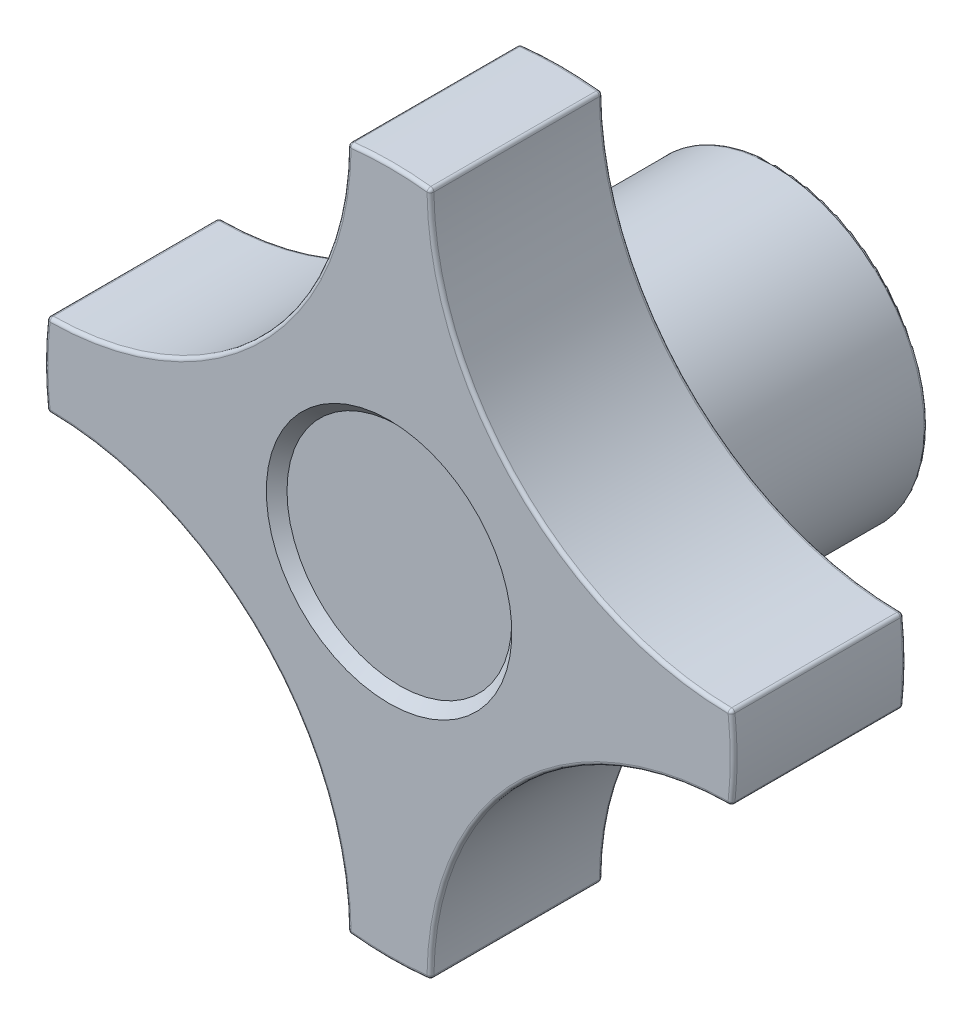
from build123d import *

# Parameters (mm, degrees)
SKETCH1_W                = 15.875
SKETCH1_H                = 6.35
LPATTERN1_COUNT          = 13
LPATTERN1_PITCH          = 1.27
LPATTERN1_COL_COUNT      = 2
LPATTERN1_COL_PITCH      = 1.27
SKETCH9_W                = 16.51
SKETCH9_H                = 6.985
CUT_EXTRUDE1_DEPTH       = 12.7
FILLET1_R                = 0.254
CIRPATTERN1_COUNT        = 4
FILLET1_OF_CIRPATTERN1_R = 0.254
FILLET2_R                = 0.254


with BuildPart() as part:
    # Sketch1 → Revolve1 (revolve)
    with BuildSketch(Plane(origin=(0, 0, 0), x_dir=(0, 0, -1), z_dir=(1, 0, 0)), mode=Mode.PRIVATE) as revolve1_sk:
        with Locations((0, 3.175)):
            Rectangle(SKETCH1_W, SKETCH1_H)
    revolve(revolve1_sk.sketch.rotate(Axis((0, 0, 8.5598), (0, 0, -1)), 180), axis=Axis((0, 0, 8.5598), (0, 0, -1)))

    # Sketch2 → Cut-Revolve1 (revolve, cut)
    with BuildSketch(Plane(origin=(0, 0, 0), x_dir=(0, 0, -1), z_dir=(1, 0, 0)), mode=Mode.PRIVATE) as cut_revolve1_sk:
        Polygon((-7.779537846, 6.365796215), (-6.673802768, 6.476369723), (-7.000308534, 5.752882994), (-7.316232842, 5.721290563), align=None)
    cut_revolve1 = revolve(cut_revolve1_sk.sketch.rotate(Axis((0, -0.135293799, 7.9375), (0, 0.09950371902099923, -0.9950371902099892)), 180), axis=Axis((0, -0.135293799, 7.9375), (0, 0.09950371902099923, -0.9950371902099892)), mode=Mode.SUBTRACT)

    # LPattern1: Cut-Revolve1 ×13
    with Locations(*[(0, 0, -i * LPATTERN1_PITCH) for i in range(1, LPATTERN1_COUNT)]):
        add(cut_revolve1, mode=Mode.SUBTRACT)

    # LPattern1 col: Cut-Revolve1 ×2
    with Locations(*[(0, 0, i * LPATTERN1_COL_PITCH) for i in range(1, LPATTERN1_COL_COUNT)]):
        add(cut_revolve1, mode=Mode.SUBTRACT)


with BuildPart() as body_2:
    # Sketch9 → Revolve4 (revolve)
    with BuildSketch(Plane(origin=(0, 0, 0), x_dir=(0, 0, -1), z_dir=(1, 0, 0)), mode=Mode.PRIVATE) as revolve4_sk:
        with Locations((-0.3175, 3.4925)):
            Rectangle(SKETCH9_W, SKETCH9_H)
    revolve(revolve4_sk.sketch.rotate(Axis((0, 0, -7.9375), (0, 0, 1)), 144.237011276), axis=Axis((0, 0, -7.9375), (0, 0, 1)))

    # Combine4: read off the stored shape, not the designer's step
    # Combine4: cut part
    add(part.part, mode=Mode.SUBTRACT)

    # Sketch8 → Cut-Revolve3 (revolve, cut)
    with BuildSketch(Plane(origin=(0, 0, 0), x_dir=(0, 0, -1), z_dir=(1, 0, 0)), mode=Mode.PRIVATE) as cut_revolve3_sk:
        Polygon((7.9375, 6.35), (7.308790563, 5.721290563), (7.308790563, 0), (7.9375, 0), align=None)
    revolve(cut_revolve3_sk.sketch.rotate(Axis((0, 0, -7.9375), (0, 0, 1)), 144.237011276), axis=Axis((0, 0, -7.9375), (0, 0, 1)), mode=Mode.SUBTRACT)


with BuildPart() as body_2_2:
    # Sketch5 → Revolve3 (revolve)
    with BuildSketch(Plane(origin=(0, 0, 0), x_dir=(0, 0, -1), z_dir=(1, 0, 0)), mode=Mode.PRIVATE) as revolve3_sk:
        Polygon((7.9375, 11.1125), (-7.9375, 11.1125), (-7.9375, 25.4), (-20.6375, 25.4), (-20.6375, 0), (-8.5725, 0), (-8.5725, 6.985), (7.9375, 6.985), align=None)
    revolve(revolve3_sk.sketch.rotate(Axis((0, 0, 8.5725), (0, 0, -1)), 215.762988724), axis=Axis((0, 0, 8.5725), (0, 0, -1)))

    # Sketch6 → Cut-Extrude1 (cut)
    with BuildSketch(Plane.XY.offset(20.6375)):
        with BuildLine():
            Line((-25.216361201, 25.216361201), (-9.541522129, 9.541522129))
            ThreePointArc((-9.541522129, 9.541522129), (-4.736196989, 16.733199425), (-3.048791197, 25.216361201))
            ThreePointArc((-3.048791197, 25.216361201), (0, 25.4), (3.048791197, 25.216361201))
            ThreePointArc((3.048791197, 25.216361201), (4.736196989, 16.733199425), (9.541522129, 9.541522129))
            Line((9.541522129, 9.541522129), (25.216361201, 25.216361201))
            ThreePointArc((25.216361201, 25.216361201), (0, 35.661320005), (-25.216361201, 25.216361201))
        make_face()
    cut_extrude1 = extrude(amount=-CUT_EXTRUDE1_DEPTH, mode=Mode.SUBTRACT)

    # Fillet1
    fillet1_edges = [body_2_2.edges().sort_by_distance(p)[0] for p in [
        (3.048791197, 25.216361201, 14.2875),
        (-3.048791197, 25.216361201, 14.2875),
    ]]
    fillet(fillet1_edges, radius=FILLET1_R)

    # CirPattern1: Cut-Extrude1 ×4 about axis
    cirpattern1_axis = Axis((0, 0, 0), (0, 0, 1))
    for i in range(1, CIRPATTERN1_COUNT):
        add(cut_extrude1.rotate(cirpattern1_axis, i * 360 / CIRPATTERN1_COUNT), mode=Mode.SUBTRACT)

    # Fillet1 of CirPattern1
    fillet1_of_cirpattern1_edges = [body_2_2.edges().sort_by_distance(p)[0] for p in [
        (-25.216361201, 3.048791197, 14.2875),
        (-25.216361201, -3.048791197, 14.2875),
        (-3.048791197, -25.216361201, 14.2875),
        (3.048791197, -25.216361201, 14.2875),
        (25.216361201, -3.048791197, 14.2875),
        (25.216361201, 3.048791197, 14.2875),
    ]]
    fillet(fillet1_of_cirpattern1_edges, radius=FILLET1_OF_CIRPATTERN1_R)

    # Fillet2
    fillet2_edges = [body_2_2.edges().sort_by_distance(p)[0] for p in [
        (-2.984403179, -25.160358744, 7.9375),
        (9.541522129, -9.541522129, 20.6375),
        (25.4, 0, 20.6375),
        (25.160358744, 2.984403179, 20.6375),
        (25.160358744, -2.984403179, 20.6375),
        (25.4, 0, 7.9375),
        (9.541522129, 9.541522129, 7.9375),
        (25.160358744, 2.984403179, 7.9375),
        (25.160358744, -2.984403179, 7.9375),
        (9.541522129, 9.541522129, 20.6375),
        (0, 25.4, 20.6375),
        (-2.984403179, 25.160358744, 20.6375),
        (2.984403179, 25.160358744, 20.6375),
        (0, 25.4, 7.9375),
        (-9.541522129, 9.541522129, 7.9375),
        (-2.984403179, 25.160358744, 7.9375),
        (2.984403179, 25.160358744, 7.9375),
        (6.494518727, 9.017143825, -7.9375),
        (-9.541522129, 9.541522129, 20.6375),
        (-25.4, 0, 20.6375),
        (-25.160358744, -2.984403179, 20.6375),
        (-25.160358744, 2.984403179, 20.6375),
        (-25.4, 0, 7.9375),
        (-9.541522129, -9.541522129, 7.9375),
        (-25.160358744, -2.984403179, 7.9375),
        (-25.160358744, 2.984403179, 7.9375),
        (-9.541522129, -9.541522129, 20.6375),
        (0, -25.4, 20.6375),
        (2.984403179, -25.160358744, 20.6375),
        (-2.984403179, -25.160358744, 20.6375),
        (0, -25.4, 7.9375),
        (9.541522129, -9.541522129, 7.9375),
        (2.984403179, -25.160358744, 7.9375),
    ]]
    fillet(fillet2_edges, radius=FILLET2_R - 0.0001)  # a hair under: the kernel refuses the full size

    # Sketch10 → Cut-Revolve4 (revolve, cut)
    with BuildSketch(Plane(origin=(0, 0, 0), x_dir=(0, 0, -1), z_dir=(1, 0, 0)), mode=Mode.PRIVATE) as cut_revolve4_sk:
        Polygon((-20.6375, 0), (-20.6375, 9.04875), (-19.8755, 8.28675), (-19.8755, 0), align=None)
    revolve(cut_revolve4_sk.sketch.rotate(Axis((0, 0, 20.6375), (0, 0, -1)), 215.762988724), axis=Axis((0, 0, 20.6375), (0, 0, -1)), mode=Mode.SUBTRACT)


solid = Compound([body_2.part, body_2_2.part])
